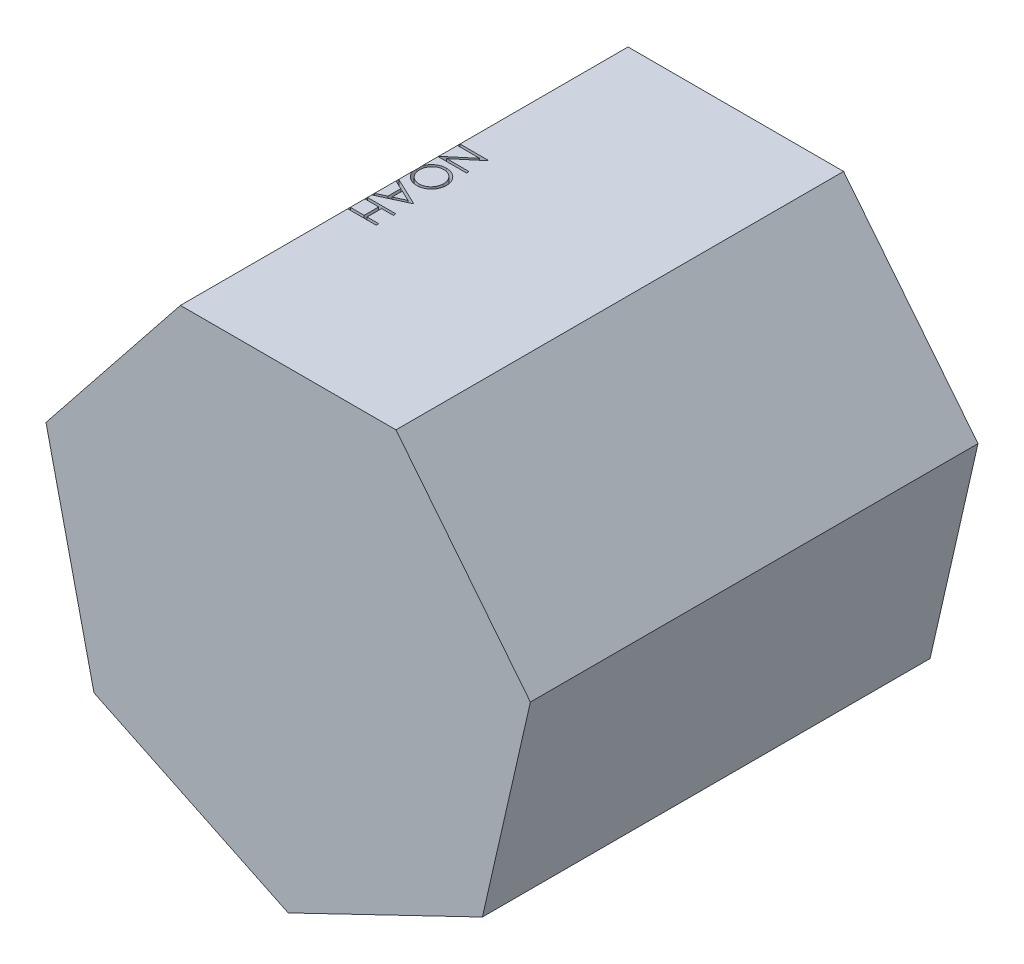
from build123d import *

# Parameters (mm, degrees)
BOSS_EXTRUDE1_DEPTH = 200
CUT_EXTRUDE1_DEPTH  = 1
SKETCH4_W           = 1.794871794
SKETCH4_H           = 20.512820513
SKETCH4_W_2         = 1.794871795
SKETCH4_H_2         = 14.615384616
CUT_EXTRUDE3_DEPTH  = 1
CUT_EXTRUDE5_DEPTH  = 2
CUT_EXTRUDE6_DEPTH  = 10


with BuildPart() as part:
    # Sketch1 → Boss-Extrude1 (new body)
    with BuildSketch(Plane.XY):
        Polygon((0, -110.991626417), (86.776747824, -69.202147163), (108.208834613, 24.697960372), (48.157461881, 100), (-48.157461881, 100), (-108.208834613, 24.697960372), (-86.776747824, -69.202147163), align=None)
    extrude(amount=BOSS_EXTRUDE1_DEPTH)

    # Sketch2 → Cut-Extrude1 (cut)
    # profile 1 of 6: a face of its own
    with BuildSketch(Plane(origin=(-78.183148247, 62.348980186, 0), x_dir=(0, 0, 1), z_dir=(-0.7818314824680302, 0.6234898018587328, 0))):
        with BuildLine():
            Line((145.128205128, -35.364993932), (143.91025641, -36.619000342))
            add(Edge.make_bspline(
                [(143.91025641, -36.619000342), (143.805167819, -36.497210935), (143.602569386, -36.262415294), (143.281246637, -35.9484892), (142.961111759, -35.684849549), (142.64654711, -35.462265212), (142.329642716, -35.293984375), (142.014117469, -35.171156592), (141.699644678, -35.095146274), (141.489438762, -35.085349481), (141.386217949, -35.080538804)],
                knots=[0, 0, 0, 0, 1.26578478, 2.440284043, 3.530471711, 4.527705817, 5.468200915, 6.346673037, 7.188140097, 8, 8, 8, 8], degree=3))
            add(Edge.make_bspline(
                [(141.386217949, -35.080538804), (141.25970715, -35.086680935), (141.010751801, -35.09876778), (140.65403284, -35.219415954), (140.322886411, -35.404608745), (140.036275097, -35.667286365), (139.793488354, -35.968796473), (139.616267319, -36.305918329), (139.50789027, -36.668478579), (139.494148944, -36.920077766), (139.487179487, -37.04768624)],
                knots=[0, 0, 0, 0, 0.99966794, 1.967205029, 2.953328237, 3.988086729, 5.028030931, 6.008226631, 6.989793394, 8, 8, 8, 8], degree=3))
            add(Edge.make_bspline(
                [(139.487179487, -37.04768624), (139.493526986, -37.163183635), (139.50620409, -37.39385284), (139.604756542, -37.734127319), (139.761705526, -38.065881823), (139.908392351, -38.26909843), (139.983974359, -38.373808035)],
                knots=[0, 0, 0, 0, 0.960159726, 1.917612774, 2.927026955, 4, 4, 4, 4], degree=3))
            add(Edge.make_bspline(
                [(139.983974359, -38.373808035), (140.029480038, -38.429719945), (140.126333139, -38.5487214), (140.308096082, -38.713886276), (140.513938956, -38.896413425), (140.761481457, -39.078909636), (141.040058759, -39.271090923), (141.355711812, -39.465388826), (141.698423269, -39.676614111), (141.943779307, -39.810582314), (142.071314103, -39.880218291)],
                knots=[0, 0, 0, 0, 0.66740084, 1.420478572, 2.27185888, 3.217733974, 4.268547843, 5.408967954, 6.65319498, 8, 8, 8, 8], degree=3))
            add(Edge.make_bspline(
                [(142.071314103, -39.880218291), (142.226820257, -39.967332021), (142.527206943, -40.135607064), (142.954022756, -40.396805369), (143.341377276, -40.656413508), (143.69255252, -40.911655073), (144.000791428, -41.169671459), (144.275446014, -41.420572928), (144.509665694, -41.671940404), (144.640830989, -41.847558196), (144.703525641, -41.931500342)],
                knots=[0, 0, 0, 0, 1.27191281, 2.456916733, 3.569705269, 4.599008579, 5.553216877, 6.436649441, 7.252746552, 8, 8, 8, 8], degree=3))
            add(Edge.make_bspline(
                [(144.703525641, -41.931500342), (144.807585798, -42.101020845), (145.014684822, -42.438398109), (145.232160631, -42.99393198), (145.358219344, -43.583134851), (145.375717745, -43.986176109), (145.384615385, -44.191115727)],
                knots=[0, 0, 0, 0, 0.995354457, 1.980940102, 2.973342416, 4, 4, 4, 4], degree=3))
            add(Edge.make_bspline(
                [(145.384615385, -44.191115727), (145.380503763, -44.335510848), (145.372401363, -44.620057209), (145.316069552, -45.039113379), (145.219183973, -45.439882279), (145.087219665, -45.826712477), (144.909023248, -46.192192132), (144.700178693, -46.545542126), (144.449464911, -46.879118874), (144.163228479, -47.19248436), (143.849825657, -47.478688631), (143.515504866, -47.730254082), (143.159854405, -47.939250295), (142.78541554, -48.112195125), (142.391337517, -48.249728027), (141.977558721, -48.344942491), (141.545394409, -48.401929698), (141.251509791, -48.40984099), (141.101762821, -48.413872137)],
                knots=[0, 0, 0, 0, 1.032770009, 2.035186124, 3.017557409, 3.978232242, 4.952395191, 5.920591857, 6.910227898, 7.931268572, 8.952309245, 9.941945286, 10.918353717, 11.897095711, 12.887975737, 13.898235213, 14.929059601, 16, 16, 16, 16], degree=3))
            add(Edge.make_bspline(
                [(141.101762821, -48.413872137), (140.899664675, -48.408199564), (140.498276521, -48.396933237), (139.904620983, -48.291184316), (139.324502362, -48.126639208), (138.762310703, -47.899691013), (138.230618624, -47.613115511), (137.744156198, -47.269901833), (137.301233555, -46.881387562), (137.049129134, -46.583599501), (136.923076923, -46.43470547)],
                knots=[0, 0, 0, 0, 1.013940152, 2.01379169, 3.017749504, 4.037548394, 5.051665909, 6.043208538, 7.021604269, 8, 8, 8, 8], degree=3))
            Line((136.923076923, -46.43470547), (138.112980769, -45.080538804))
            add(Edge.make_bspline(
                [(138.112980769, -45.080538804), (138.225965986, -45.20256603), (138.445004913, -45.439134258), (138.795297581, -45.75413049), (139.151751301, -46.018137754), (139.510806653, -46.238957267), (139.877778621, -46.409102428), (140.250610702, -46.52863725), (140.628544554, -46.605461206), (140.88238533, -46.614479962), (141.009615385, -46.619000342)],
                knots=[0, 0, 0, 0, 1.179806542, 2.287233372, 3.337373186, 4.324005949, 5.273901747, 6.200048787, 7.097828587, 8, 8, 8, 8], degree=3))
            add(Edge.make_bspline(
                [(141.009615385, -46.619000342), (141.182860676, -46.611167057), (141.521352913, -46.595862133), (142.006174391, -46.456907321), (142.453823685, -46.239021882), (142.842528517, -45.929966464), (143.173398009, -45.570220335), (143.412987577, -45.164996796), (143.563137151, -44.726188472), (143.580771429, -44.422003886), (143.58974359, -44.267237522)],
                knots=[0, 0, 0, 0, 1.072336372, 2.095165389, 3.102688358, 4.141489647, 5.156069229, 6.117746104, 7.042326257, 8, 8, 8, 8], degree=3))
            add(Edge.make_bspline(
                [(143.58974359, -44.267237522), (143.583536194, -44.139753987), (143.571280521, -43.888054811), (143.475033252, -43.523767148), (143.322959811, -43.178228402), (143.173218963, -42.976001846), (143.096955128, -42.873006753)],
                knots=[0, 0, 0, 0, 1.013901739, 2.00181326, 2.98231254, 4, 4, 4, 4], degree=3))
            add(Edge.make_bspline(
                [(143.096955128, -42.873006753), (143.051112874, -42.821376112), (142.951251889, -42.708905929), (142.768079082, -42.546476907), (142.548754155, -42.371402054), (142.290810367, -42.186650118), (141.993727727, -41.994658087), (141.656302153, -41.796433217), (141.283156139, -41.582560499), (141.01932396, -41.440733897), (140.881410256, -41.366596496)],
                knots=[0, 0, 0, 0, 0.615000592, 1.339693406, 2.178160186, 3.116406724, 4.166410947, 5.330106347, 6.604359322, 8, 8, 8, 8], degree=3))
            add(Edge.make_bspline(
                [(140.881410256, -41.366596496), (140.732572313, -41.283515744), (140.443928042, -41.122395651), (140.035086379, -40.871446621), (139.666244355, -40.616205051), (139.328526786, -40.370988827), (139.030463897, -40.122869147), (138.773229907, -39.871570567), (138.546697245, -39.62722779), (138.421283463, -39.45410038), (138.361378205, -39.371404188)],
                knots=[0, 0, 0, 0, 1.262093308, 2.447601706, 3.550203992, 4.582594899, 5.537233252, 6.418365656, 7.244515135, 8, 8, 8, 8], degree=3))
            add(Edge.make_bspline(
                [(138.361378205, -39.371404188), (138.257774779, -39.204857817), (138.05053172, -38.871706872), (137.849302056, -38.315647005), (137.710981891, -37.730246678), (137.698625376, -37.326321796), (137.692307692, -37.119801624)],
                knots=[0, 0, 0, 0, 0.985009483, 1.970363186, 2.962279964, 4, 4, 4, 4], degree=3))
            add(Edge.make_bspline(
                [(137.692307692, -37.119801624), (137.695360237, -36.98479935), (137.701334499, -36.720580773), (137.749014794, -36.332358943), (137.835824572, -35.96351235), (137.944709844, -35.608501704), (138.096041298, -35.274204024), (138.276875042, -34.956161332), (138.489374613, -34.654813229), (138.734193418, -34.374795331), (139.003374248, -34.120456324), (139.294201504, -33.898749878), (139.600134398, -33.709570708), (139.922468224, -33.550912648), (140.264299498, -33.430904747), (140.623238849, -33.348291118), (140.998559734, -33.293118531), (141.255137597, -33.28818662), (141.386217949, -33.285667009)],
                knots=[0, 0, 0, 0, 1.087655834, 2.128696564, 3.144119009, 4.137814668, 5.115653402, 6.093965665, 7.082169637, 8.081268856, 9.086088321, 10.061021666, 11.022561449, 11.980240094, 12.950172527, 13.934149372, 14.944599409, 16, 16, 16, 16], degree=3))
            add(Edge.make_bspline(
                [(141.386217949, -33.285667009), (141.541601169, -33.291977527), (141.855282436, -33.304716943), (142.325880299, -33.405892317), (142.795785111, -33.572367198), (143.266204254, -33.802288531), (143.733691622, -34.099813536), (144.202359374, -34.459409533), (144.677833833, -34.878710759), (144.974727051, -35.199277761), (145.128205128, -35.364993932)],
                knots=[0, 0, 0, 0, 0.845714091, 1.707292901, 2.609013841, 3.555613372, 4.552488639, 5.621697636, 6.770543573, 8, 8, 8, 8], degree=3))
        make_face()
    # profile 2 of 6: a face of its own
    with BuildSketch(Plane(origin=(-78.183148247, 62.348980186, 0), x_dir=(0, 0, 1), z_dir=(-0.7818314824680302, 0.6234898018587328, 0))):
        with BuildLine():
            Line((132.251602564, -43.542077265), (133.846153846, -44.379417009))
            add(Edge.make_bspline(
                [(133.846153846, -44.379417009), (133.719087588, -44.604807473), (133.471866968, -45.043328061), (133.046719837, -45.645795835), (132.601050851, -46.187782783), (132.114742462, -46.654809379), (131.602344297, -47.06196015), (131.061014841, -47.418176291), (130.487935882, -47.721710693), (129.883080312, -47.977439424), (129.241368591, -48.174065104), (128.56124564, -48.312946367), (127.841408524, -48.398793616), (127.348001782, -48.408765849), (127.095352564, -48.413872137)],
                knots=[0, 0, 0, 0, 1.120438281, 2.179929193, 3.190490725, 4.156257408, 5.095198341, 6.022838206, 6.959905092, 7.901321166, 8.864066838, 9.862729781, 10.905609505, 12, 12, 12, 12], degree=3))
            add(Edge.make_bspline(
                [(127.095352564, -48.413872137), (126.814541264, -48.40731685), (126.266759769, -48.394529383), (125.469389785, -48.284286729), (124.718650252, -48.104444679), (124.014583375, -47.853213013), (123.35891336, -47.525056876), (122.750337047, -47.125288408), (122.185654042, -46.655961239), (121.682658561, -46.113010133), (121.229836374, -45.531970377), (120.83026026, -44.92650818), (120.496217797, -44.298146897), (120.224488596, -43.65088676), (120.005032225, -42.988807368), (119.852079632, -42.305884696), (119.763909643, -41.603967072), (119.750398526, -41.129125154), (119.743589744, -40.889833676)],
                knots=[0, 0, 0, 0, 1.145258523, 2.234067595, 3.276747158, 4.290159414, 5.277019952, 6.260822364, 7.254936242, 8.264827045, 9.274100331, 10.257902744, 11.220704747, 12.172965371, 13.118907548, 14.062713208, 15.023725156, 16, 16, 16, 16], degree=3))
            add(Edge.make_bspline(
                [(119.743589744, -40.889833676), (119.74964198, -40.665291788), (119.761636713, -40.220279418), (119.837241212, -39.561619163), (119.971231458, -38.921456578), (120.155096166, -38.299259732), (120.392531859, -37.696070395), (120.683001683, -37.11152146), (121.026958127, -36.546234946), (121.292516263, -36.189645611), (121.426282051, -36.010025983)],
                knots=[0, 0, 0, 0, 1.024358464, 2.0301432, 3.019427413, 4.004406732, 4.986367066, 5.972626655, 6.978780325, 8, 8, 8, 8], degree=3))
            add(Edge.make_bspline(
                [(121.426282051, -36.010025983), (121.60746881, -35.79363244), (121.964102791, -35.367700152), (122.567281964, -34.808052576), (123.220425943, -34.339231003), (123.915349521, -33.950618797), (124.660129373, -33.655340814), (125.444753893, -33.435297487), (126.278157243, -33.311994567), (126.847901362, -33.294578375), (127.139423077, -33.285667009)],
                knots=[0, 0, 0, 0, 1.030682036, 2.02871468, 2.997146059, 3.962720338, 4.930598197, 5.918074684, 6.934738563, 8, 8, 8, 8], degree=3))
            add(Edge.make_bspline(
                [(127.139423077, -33.285667009), (127.439123679, -33.293404431), (128.027067941, -33.30858349), (128.884394347, -33.449305395), (129.695598442, -33.67246285), (130.460355609, -33.987627367), (131.178743385, -34.394253377), (131.84609224, -34.897921043), (132.473815168, -35.483167255), (132.839007048, -35.933242738), (133.024839744, -36.162269573)],
                knots=[0, 0, 0, 0, 1.056321875, 2.072262726, 3.055038591, 4.01806755, 4.982017516, 5.957941055, 6.960871419, 8, 8, 8, 8], degree=3))
            add(Edge.make_bspline(
                [(133.024839744, -36.162269573), (133.151279391, -36.334861467), (133.403317066, -36.678896431), (133.71901478, -37.239874471), (133.993057037, -37.826792153), (134.212102529, -38.449136708), (134.389471107, -39.099534309), (134.517795786, -39.782634564), (134.593050749, -40.498234058), (134.607843305, -40.985814375), (134.615384615, -41.234384958)],
                knots=[0, 0, 0, 0, 0.94817472, 1.890038105, 2.849395472, 3.817997239, 4.812318967, 5.836947057, 6.897266129, 8, 8, 8, 8], degree=3))
            Line((134.615384615, -41.234384958), (121.538461538, -41.234384958))
            add(Edge.make_bspline(
                [(121.538461538, -41.234384958), (121.547259289, -41.426959039), (121.564559712, -41.805648203), (121.645217673, -42.359766964), (121.772353523, -42.887614633), (121.951033881, -43.385232016), (122.167415854, -43.859118459), (122.432477093, -44.30575867), (122.748703115, -44.723118271), (123.101421398, -45.114930485), (123.494033371, -45.463849121), (123.907077641, -45.776144985), (124.346469441, -46.037891252), (124.808744203, -46.250347765), (125.293154404, -46.416669571), (125.799852662, -46.530199975), (126.327841898, -46.606240585), (126.687760379, -46.614695815), (126.87099359, -46.619000342)],
                knots=[0, 0, 0, 0, 1.094153842, 2.151609401, 3.174256925, 4.172055639, 5.149267565, 6.128595816, 7.11444997, 8.118368179, 9.117203808, 10.09244225, 11.054858984, 12.015122123, 12.976791628, 13.957293641, 14.960065497, 16, 16, 16, 16], degree=3))
            add(Edge.make_bspline(
                [(126.87099359, -46.619000342), (127.050143005, -46.615525733), (127.40560981, -46.608631441), (127.934986138, -46.54159195), (128.455783437, -46.433190375), (128.965846199, -46.285247575), (129.454822461, -46.10480842), (129.907654176, -45.887077805), (130.324112551, -45.646222109), (130.71335236, -45.370738252), (131.090900893, -45.033548612), (131.465429387, -44.612773063), (131.867010263, -44.115130047), (132.118379365, -43.740583384), (132.251602564, -43.542077265)],
                knots=[0, 0, 0, 0, 0.99110716, 1.966546729, 2.947904876, 3.932708344, 4.903319531, 5.828989031, 6.710028674, 7.56322171, 8.463672341, 9.504779593, 10.677557249, 12, 12, 12, 12], degree=3))
        make_face()
        with BuildLine():
            add(Edge.make_bspline(
                [(132.820512821, -39.439513163), (132.754817823, -39.201439599), (132.6283761, -38.743224624), (132.364168303, -38.10870525), (132.066616642, -37.544774387), (131.714492463, -37.055747912), (131.315528317, -36.621442124), (130.854698701, -36.241907352), (130.337922167, -35.90237906), (129.767869935, -35.615793349), (129.164202592, -35.371851299), (128.532167209, -35.208279209), (127.887265564, -35.096224681), (127.451069642, -35.085789776), (127.231570513, -35.080538804)],
                knots=[0, 0, 0, 0, 1.154881502, 2.222775134, 3.210006277, 4.132804581, 5.035138423, 5.962687519, 6.919655026, 7.923214229, 8.944639381, 9.960483929, 10.97369054, 12, 12, 12, 12], degree=3))
            add(Edge.make_bspline(
                [(127.231570513, -35.080538804), (127.052430864, -35.08403407), (126.698309441, -35.090943476), (126.176589051, -35.156487072), (125.6755622, -35.264829043), (125.191531985, -35.413200223), (124.730841309, -35.610963666), (124.284014062, -35.842867818), (123.862411798, -36.125962583), (123.598747252, -36.341727468), (123.465544872, -36.450731112)],
                knots=[0, 0, 0, 0, 1.04873581, 2.073130211, 3.073294108, 4.04793562, 5.032784715, 6.005352987, 6.992311501, 8, 8, 8, 8], degree=3))
            add(Edge.make_bspline(
                [(123.465544872, -36.450731112), (123.370154689, -36.536984344), (123.177108208, -36.711539864), (122.919162371, -37.012278187), (122.672188241, -37.336572828), (122.447424511, -37.696830683), (122.241266874, -38.08894942), (122.048352719, -38.509621621), (121.874716078, -38.962039509), (121.777024021, -39.27731059), (121.726762821, -39.439513163)],
                knots=[0, 0, 0, 0, 0.879870761, 1.780643979, 2.707998968, 3.669668524, 4.684282772, 5.740141944, 6.837334558, 8, 8, 8, 8], degree=3))
            Line((121.726762821, -39.439513163), (132.820512821, -39.439513163))
        make_face(mode=Mode.SUBTRACT)
    # profile 3 of 6: a face of its own
    with BuildSketch(Plane(origin=(-78.183148247, 62.348980186, 0), x_dir=(0, 0, 1), z_dir=(-0.7818314824680302, 0.6234898018587328, 0))):
        with BuildLine():
            Line((111.538461538, -33.542077265), (113.333333333, -33.542077265))
            Line((113.333333333, -33.542077265), (113.333333333, -35.693519573))
            add(Edge.make_bspline(
                [(113.333333333, -35.693519573), (113.465840526, -35.493200554), (113.719259503, -35.110091987), (114.140476242, -34.603410267), (114.571923849, -34.183895715), (115.015667777, -33.849589893), (115.474971205, -33.599229214), (115.939753786, -33.415840442), (116.4173279, -33.307398641), (116.738253181, -33.29292059), (116.899038462, -33.285667009)],
                knots=[0, 0, 0, 0, 1.2804753, 2.448899062, 3.506932113, 4.484331642, 5.4025378, 6.288909075, 7.142734305, 8, 8, 8, 8], degree=3))
            add(Edge.make_bspline(
                [(116.899038462, -33.285667009), (117.023760327, -33.292470018), (117.280383671, -33.306467651), (117.668855613, -33.404815221), (118.06910391, -33.561832493), (118.327060408, -33.709490908), (118.461538462, -33.786468291)],
                knots=[0, 0, 0, 0, 0.901110191, 1.854092781, 2.881294221, 4, 4, 4, 4], degree=3))
            Line((118.461538462, -33.786468291), (117.475961538, -35.34095547))
            add(Edge.make_bspline(
                [(117.475961538, -35.34095547), (117.389624275, -35.302439664), (117.22573962, -35.22932929), (116.985999242, -35.142803518), (116.764963032, -35.091855428), (116.624142698, -35.084137042), (116.55849359, -35.080538804)],
                knots=[0, 0, 0, 0, 1.180555205, 2.24091978, 3.179933427, 4, 4, 4, 4], degree=3))
            add(Edge.make_bspline(
                [(116.55849359, -35.080538804), (116.414460827, -35.090139017), (116.120675741, -35.10972067), (115.689335745, -35.263656715), (115.270780285, -35.512372372), (114.938370786, -35.788207297), (114.680986483, -36.054194711), (114.497328052, -36.286471297), (114.328855212, -36.54692062), (114.167882524, -36.831090242), (114.021217986, -37.143832219), (113.884334162, -37.48202201), (113.760569231, -37.846051318), (113.689996407, -38.099665719), (113.653846154, -38.229577265)],
                knots=[0, 0, 0, 0, 1.125678352, 2.296057538, 3.5422874, 4.923748041, 5.663163013, 6.437101912, 7.23742474, 8.08941207, 8.991984279, 9.93940061, 10.944477711, 12, 12, 12, 12], degree=3))
            add(Edge.make_bspline(
                [(113.653846154, -38.229577265), (113.626803906, -38.345446829), (113.566907382, -38.602089107), (113.508670023, -39.032652105), (113.45112992, -39.541358727), (113.410577815, -40.129624972), (113.372989003, -40.795981794), (113.351788533, -41.54144434), (113.334056302, -42.366777776), (113.333581634, -42.94377408), (113.333333333, -43.245602906)],
                knots=[0, 0, 0, 0, 0.566838948, 1.255505196, 2.06880316, 3.007127437, 4.065329342, 5.249902469, 6.561414163, 8, 8, 8, 8], degree=3))
            Line((113.333333333, -43.245602906), (113.333333333, -48.157461881))
            Line((113.333333333, -48.157461881), (111.538461538, -48.157461881))
            Line((111.538461538, -48.157461881), (111.538461538, -33.542077265))
        make_face()
    # profile 4 of 6: a face of its own
    with BuildSketch(Plane(origin=(-78.183148247, 62.348980186, 0), x_dir=(0, 0, 1), z_dir=(-0.7818314824680302, 0.6234898018587328, 0))):
        with BuildLine():
            Line((107.948717949, -27.644641368), (107.948717949, -48.157461881))
            Line((107.948717949, -48.157461881), (106.153846154, -48.157461881))
            Line((106.153846154, -48.157461881), (106.153846154, -45.629417009))
            add(Edge.make_bspline(
                [(106.153846154, -45.629417009), (105.951453065, -45.858214689), (105.556480406, -46.304716238), (104.896816875, -46.888042938), (104.197570144, -47.370204775), (103.462134023, -47.759632865), (102.691172632, -48.052158901), (101.886394991, -48.26007981), (101.047472814, -48.393758868), (100.474602216, -48.407107565), (100.184294872, -48.413872137)],
                knots=[0, 0, 0, 0, 1.074387032, 2.096679803, 3.090159297, 4.057316773, 5.018401886, 5.985159533, 6.978961417, 8, 8, 8, 8], degree=3))
            add(Edge.make_bspline(
                [(100.184294872, -48.413872137), (99.926192278, -48.406864296), (99.417202536, -48.393044522), (98.668464953, -48.285831358), (97.947937813, -48.113656377), (97.254940255, -47.874222723), (96.593956567, -47.556618028), (95.959327443, -47.176382325), (95.354340631, -46.723577582), (94.788217551, -46.205931705), (94.266891835, -45.643674636), (93.809398849, -45.043985797), (93.427952678, -44.409458346), (93.108980788, -43.748126038), (92.863287391, -43.054897926), (92.692009481, -42.332171252), (92.584921215, -41.580800546), (92.571107153, -41.069146129), (92.564102564, -40.80970547)],
                knots=[0, 0, 0, 0, 1.033919861, 2.038935746, 3.024066025, 3.998881131, 4.97069526, 5.957263378, 6.95902576, 7.993208707, 9.027059324, 10.027763471, 11.009749337, 11.988697705, 12.965288445, 13.950418724, 14.960734635, 16, 16, 16, 16], degree=3))
            add(Edge.make_bspline(
                [(92.564102564, -40.80970547), (92.571262401, -40.555627164), (92.585417011, -40.05332806), (92.690863982, -39.314592643), (92.868184031, -38.603059724), (93.117028875, -37.921020049), (93.43612576, -37.267648333), (93.824286258, -36.642482476), (94.281538399, -36.043800205), (94.80869501, -35.485678909), (95.37975084, -34.970132542), (95.990657874, -34.522080853), (96.626219481, -34.135127432), (97.296293827, -33.828536138), (97.990962997, -33.580484112), (98.716411259, -33.408867152), (99.46962028, -33.307739602), (99.98099452, -33.293095235), (100.240384615, -33.285667009)],
                knots=[0, 0, 0, 0, 1.020392517, 2.01726096, 2.990465484, 3.961182959, 4.928053699, 5.906110375, 6.912531644, 7.948652711, 8.985773172, 9.998621852, 10.987621588, 11.969261332, 12.953316658, 13.946091881, 14.958173133, 16, 16, 16, 16], degree=3))
            add(Edge.make_bspline(
                [(100.240384615, -33.285667009), (100.538766374, -33.294621843), (101.124456606, -33.312199188), (101.981019586, -33.459092714), (102.791234504, -33.70573773), (103.559765861, -34.043402195), (104.282031919, -34.482263631), (104.963327008, -35.012271904), (105.591803139, -35.648427025), (105.963642125, -36.126207444), (106.153846154, -36.370602906)],
                knots=[0, 0, 0, 0, 1.031072012, 2.023879775, 2.993683497, 3.952812103, 4.918022106, 5.908088563, 6.929940113, 8, 8, 8, 8], degree=3))
            Line((106.153846154, -36.370602906), (106.153846154, -27.644641368))
            Line((106.153846154, -27.644641368), (107.948717949, -27.644641368))
        make_face()
        with BuildLine():
            add(Edge.make_bspline(
                [(100.264423077, -35.080538804), (100.002055432, -35.089873877), (99.484183432, -35.108299825), (98.723931992, -35.252148369), (97.996426768, -35.491488909), (97.305306344, -35.818814058), (96.661487963, -36.230406839), (96.086095559, -36.728243315), (95.574422979, -37.298740538), (95.144090041, -37.939324026), (94.793287201, -38.626055975), (94.546618447, -39.343909907), (94.383937034, -40.07993835), (94.367316916, -40.579153698), (94.358974359, -40.829737522)],
                knots=[0, 0, 0, 0, 1.031046209, 2.035121221, 3.029706178, 4.034933723, 5.034054252, 6.02443088, 7.017295772, 8.038157696, 9.050218397, 10.03989886, 11.016116709, 12, 12, 12, 12], degree=3))
            add(Edge.make_bspline(
                [(94.358974359, -40.829737522), (94.369630892, -41.078823849), (94.390902189, -41.576020168), (94.543763299, -42.313052035), (94.800219719, -43.031075133), (95.150174363, -43.723995095), (95.588383647, -44.367332812), (96.096318805, -44.948704941), (96.678891841, -45.448645445), (97.324191881, -45.867145866), (98.013380284, -46.205217414), (98.738145606, -46.44044964), (99.484863539, -46.592322672), (99.992591161, -46.610062539), (100.248397436, -46.619000342)],
                knots=[0, 0, 0, 0, 0.979072187, 1.954306742, 2.945804271, 3.96968567, 4.997920485, 5.998718438, 6.996577872, 8.005894225, 9.015743152, 10.005417472, 10.995077863, 12, 12, 12, 12], degree=3))
            add(Edge.make_bspline(
                [(100.248397436, -46.619000342), (100.508091737, -46.609514834), (101.024597946, -46.590649099), (101.787104848, -46.446184726), (102.527076064, -46.207505878), (103.234431655, -45.876653726), (103.893380976, -45.466611692), (104.484797419, -44.986571172), (104.984888667, -44.428267263), (105.408846436, -43.814687531), (105.741277389, -43.142047551), (105.983426298, -42.425852175), (106.126591474, -41.666076472), (106.144635644, -41.146854032), (106.153846154, -40.881820855)],
                knots=[0, 0, 0, 0, 1.01762866, 2.023962475, 3.030623092, 4.058876274, 5.077231937, 6.066672613, 7.034107872, 8.005628644, 8.981990164, 9.965428785, 10.961468474, 12, 12, 12, 12], degree=3))
            add(Edge.make_bspline(
                [(106.153846154, -40.881820855), (106.148362403, -40.679890395), (106.137568646, -40.282427347), (106.055108249, -39.698841533), (105.923937241, -39.140363098), (105.739101984, -38.606404875), (105.496294644, -38.099919073), (105.203450268, -37.617269014), (104.855419126, -37.160964949), (104.45780372, -36.737290258), (104.022573991, -36.350853331), (103.562033759, -36.005914812), (103.070726634, -35.722550397), (102.556914994, -35.488028845), (102.019707369, -35.301405132), (101.454732398, -35.176904024), (100.86799533, -35.091416476), (100.467732156, -35.084202871), (100.264423077, -35.080538804)],
                knots=[0, 0, 0, 0, 1.050140795, 2.067009409, 3.05949893, 4.030605086, 5.00011959, 5.97591094, 6.962425594, 7.979863591, 8.993523472, 9.986985069, 10.967611495, 11.937549037, 12.921786183, 13.919465291, 14.943216303, 16, 16, 16, 16], degree=3))
        make_face(mode=Mode.SUBTRACT)
    # profile 5 of 6: a face of its own
    with BuildSketch(Plane(origin=(-78.183148247, 62.348980186, 0), x_dir=(0, 0, 1), z_dir=(-0.7818314824680302, 0.6234898018587328, 0))):
        with BuildLine():
            Line((76.153846154, -33.542077265), (77.948717949, -33.542077265))
            Line((77.948717949, -33.542077265), (77.948717949, -36.178295214))
            add(Edge.make_bspline(
                [(77.948717949, -36.178295214), (78.140361578, -35.939193941), (78.512252727, -35.475209578), (79.131591774, -34.865377723), (79.786128347, -34.36283358), (80.471854082, -33.962240472), (81.189699854, -33.660259751), (81.935289968, -33.442168716), (82.713088288, -33.311398268), (83.242027928, -33.294311237), (83.509615385, -33.285667009)],
                knots=[0, 0, 0, 0, 1.12780773, 2.188550248, 3.19190651, 4.159438251, 5.104880172, 6.052711206, 7.014878035, 8, 8, 8, 8], degree=3))
            add(Edge.make_bspline(
                [(83.509615385, -33.285667009), (83.780076151, -33.295639554), (84.30943311, -33.315158231), (85.080164889, -33.469539323), (85.800012853, -33.733226495), (86.466410315, -34.094438326), (87.067137248, -34.543618174), (87.594707828, -35.066919784), (88.031069241, -35.66884026), (88.323625601, -36.227258296), (88.516343588, -36.722622834), (88.637671231, -37.146889978), (88.740705411, -37.619565127), (88.830029685, -38.139219922), (88.890470325, -38.709495295), (88.938140562, -39.328053535), (88.972304529, -39.994694281), (88.973659998, -40.455760723), (88.974358974, -40.693519573)],
                knots=[0, 0, 0, 0, 1.235846778, 2.418850247, 3.575807741, 4.728682307, 5.871620074, 6.994088408, 8.11269785, 9.256955736, 9.865816715, 10.540099792, 11.271859618, 12.076849838, 12.949306005, 13.892391288, 14.913166135, 16, 16, 16, 16], degree=3))
            Line((88.974358974, -40.693519573), (88.974358974, -48.157461881))
            Line((88.974358974, -48.157461881), (87.179487179, -48.157461881))
            Line((87.179487179, -48.157461881), (87.179487179, -41.282461881))
            add(Edge.make_bspline(
                [(87.179487179, -41.282461881), (87.178383134, -41.083476481), (87.176271282, -40.702851277), (87.169610444, -40.15788543), (87.153554406, -39.66367641), (87.130992618, -39.22140574), (87.097969586, -38.831498102), (87.06355455, -38.493159378), (87.021468968, -38.206819135), (86.983966608, -38.034447236), (86.967147436, -37.957141368)],
                knots=[0, 0, 0, 0, 1.430800155, 2.736877192, 3.918605307, 4.986035426, 5.920637409, 6.731861385, 7.431261377, 8, 8, 8, 8], degree=3))
            add(Edge.make_bspline(
                [(86.967147436, -37.957141368), (86.906430113, -37.730220311), (86.789568052, -37.293467485), (86.500802434, -36.701042613), (86.136149973, -36.197052968), (85.691019405, -35.784614559), (85.169710401, -35.463638349), (84.573669585, -35.240930036), (83.908648781, -35.101637069), (83.440909452, -35.087767743), (83.197115385, -35.080538804)],
                knots=[0, 0, 0, 0, 1.084156227, 2.086665306, 3.027808233, 3.945421172, 4.874247719, 5.839848303, 6.874090471, 8, 8, 8, 8], degree=3))
            add(Edge.make_bspline(
                [(83.197115385, -35.080538804), (83.052728621, -35.08325883), (82.766990947, -35.088641693), (82.343276822, -35.14264911), (81.932281546, -35.230983142), (81.529880352, -35.350232499), (81.144121531, -35.514016895), (80.762611295, -35.69989901), (80.3997155, -35.931603079), (80.047696088, -36.189835201), (79.72019433, -36.4760021), (79.415460968, -36.777970729), (79.143815138, -37.099545608), (78.897708422, -37.435545308), (78.685261203, -37.790584382), (78.499814985, -38.161237562), (78.342468158, -38.547992698), (78.264281344, -38.81642162), (78.225160256, -38.950731112)],
                knots=[0, 0, 0, 0, 1.023777757, 2.026029729, 3.023749952, 4.003683103, 4.997618607, 5.993177895, 7.010360494, 8.046726602, 9.087585522, 10.09234134, 11.086953743, 12.070360549, 13.043493632, 14.017870808, 15.008233677, 16, 16, 16, 16], degree=3))
            add(Edge.make_bspline(
                [(78.225160256, -38.950731112), (78.202647979, -39.049332272), (78.153639928, -39.26398184), (78.100707472, -39.616235665), (78.052664184, -40.023721236), (78.012452992, -40.485963048), (77.987850612, -41.004579477), (77.961025487, -41.577355693), (77.951259424, -42.206575627), (77.94958883, -42.644642442), (77.948717949, -42.873006753)],
                knots=[0, 0, 0, 0, 0.615963638, 1.340920617, 2.168419149, 3.115676021, 4.16674242, 5.331190069, 6.6087489, 8, 8, 8, 8], degree=3))
            Line((77.948717949, -42.873006753), (77.948717949, -48.157461881))
            Line((77.948717949, -48.157461881), (76.153846154, -48.157461881))
            Line((76.153846154, -48.157461881), (76.153846154, -33.542077265))
        make_face()
    # profile 6 of 6: a face of its own
    with BuildSketch(Plane(origin=(-78.183148247, 62.348980186, 0), x_dir=(0, 0, 1), z_dir=(-0.7818314824680302, 0.6234898018587328, 0))):
        Polygon((63.846153846, -28.157461881), (73.076923077, -48.157461881), (71.125801282, -48.157461881), (68.169070513, -41.74720547), (59.102564103, -41.74720547), (56.065705128, -48.157461881), (54.102564103, -48.157461881), (63.58974359, -28.157461881), align=None)
        Polygon((63.697916667, -32.05970547), (60.080128205, -39.695923419), (67.223557692, -39.695923419), align=None, mode=Mode.SUBTRACT)
    extrude(amount=-CUT_EXTRUDE1_DEPTH, mode=Mode.SUBTRACT)

    # Sketch4 → Cut-Extrude3 (cut)
    # profile 1 of 6: a face of its own
    with BuildSketch(Plane(origin=(-97.492791218, -22.252093396, 0), x_dir=(0, 0, 1), z_dir=(-0.9749279121818235, -0.22252093395631528, 0))):
        Polygon((109.743589744, -33.542077265), (111.674679487, -33.542077265), (116.630608974, -44.735987522), (121.650641026, -33.542077265), (123.58974359, -33.542077265), (114.615384615, -53.542077265), (112.676282051, -53.542077265), (115.661057692, -46.90345547), align=None)
    # profile 2 of 6: a face of its own
    with BuildSketch(Plane(origin=(-97.492791218, -22.252093396, 0), x_dir=(0, 0, 1), z_dir=(-0.9749279121818235, -0.22252093395631528, 0))):
        with Locations((106.282051282, -37.901051624)):
            Rectangle(SKETCH4_W, SKETCH4_H)
    # profile 3 of 6: a face of its own
    with BuildSketch(Plane(origin=(-97.492791218, -22.252093396, 0), x_dir=(0, 0, 1), z_dir=(-0.9749279121818235, -0.22252093395631528, 0))):
        with Locations((100.641025641, -37.901051624)):
            Rectangle(SKETCH4_W, SKETCH4_H)
    # profile 4 of 6: a face of its own
    with BuildSketch(Plane(origin=(-97.492791218, -22.252093396, 0), x_dir=(0, 0, 1), z_dir=(-0.9749279121818235, -0.22252093395631528, 0))):
        with BuildLine():
            add(Edge.make_bspline(
                [(94.735576923, -27.388231112), (94.84695587, -27.393397697), (95.065057241, -27.403514863), (95.380447342, -27.490151874), (95.667630268, -27.63700722), (95.92236017, -27.834033968), (96.14094238, -28.065745073), (96.293975011, -28.335807749), (96.39233156, -28.6275714), (96.404209019, -28.831086195), (96.41025641, -28.93470547)],
                knots=[0, 0, 0, 0, 1.055194115, 2.066272739, 3.074728998, 4.095836921, 5.109056067, 6.073838105, 7.019297344, 8, 8, 8, 8], degree=3))
            add(Edge.make_bspline(
                [(96.41025641, -28.93470547), (96.40407264, -29.035634917), (96.391848058, -29.235160489), (96.294050982, -29.521866043), (96.139638194, -29.788176235), (95.922500333, -30.019437436), (95.667593128, -30.216355264), (95.380457209, -30.363239487), (95.065054646, -30.449868843), (94.846954993, -30.459987064), (94.735576923, -30.465154188)],
                knots=[0, 0, 0, 0, 0.96129708, 1.900370562, 2.859976407, 3.87933698, 4.906634145, 5.921202961, 6.938410037, 8, 8, 8, 8], degree=3))
            add(Edge.make_bspline(
                [(94.735576923, -30.465154188), (94.625472494, -30.460184359), (94.411168607, -30.450511234), (94.100500936, -30.361539704), (93.815766711, -30.216305001), (93.56054001, -30.0207268), (93.34779605, -29.786755959), (93.192948476, -29.522028565), (93.095377265, -29.235119111), (93.083122244, -29.035621017), (93.076923077, -28.93470547)],
                knots=[0, 0, 0, 0, 1.054934014, 2.053291228, 3.073705704, 4.106921865, 5.123545215, 6.088680038, 7.033164197, 8, 8, 8, 8], degree=3))
            add(Edge.make_bspline(
                [(93.076923077, -28.93470547), (93.082986429, -28.831100616), (93.094895235, -28.627614144), (93.193021613, -28.335642527), (93.346506229, -28.067176802), (93.560680878, -27.832745377), (93.815729222, -27.637057178), (94.100510623, -27.49185157), (94.411166048, -27.402872488), (94.625471625, -27.393200406), (94.735576923, -27.388231112)],
                knots=[0, 0, 0, 0, 0.98631895, 1.937192651, 2.907499808, 3.917963147, 4.944918757, 5.95915025, 6.951458133, 8, 8, 8, 8], degree=3))
        make_face()
    # profile 5 of 6: a face of its own
    with BuildSketch(Plane(origin=(-97.492791218, -22.252093396, 0), x_dir=(0, 0, 1), z_dir=(-0.9749279121818235, -0.22252093395631528, 0))):
        with Locations((94.743589744, -40.849769573)):
            Rectangle(SKETCH4_W_2, SKETCH4_H_2)
    # profile 6 of 6: a face of its own
    with BuildSketch(Plane(origin=(-97.492791218, -22.252093396, 0), x_dir=(0, 0, 1), z_dir=(-0.9749279121818235, -0.22252093395631528, 0))):
        with BuildLine():
            Line((78.717948718, -28.157461881), (82.620192308, -28.157461881))
            add(Edge.make_bspline(
                [(82.620192308, -28.157461881), (82.811212183, -28.158466169), (83.181456242, -28.160412729), (83.719853053, -28.19060205), (84.224131971, -28.231765878), (84.694439241, -28.297080693), (85.13055754, -28.375890848), (85.533801182, -28.471329797), (85.90288788, -28.585767589), (86.343532089, -28.767746339), (86.845935865, -29.038164444), (87.38992668, -29.437756245), (87.855093762, -29.926513177), (88.256158432, -30.477842637), (88.575021973, -31.084332761), (88.805703672, -31.731528125), (88.951748674, -32.411080936), (88.966768298, -32.877613381), (88.974358974, -33.113391368)],
                knots=[0, 0, 0, 0, 1.001505555, 1.941167018, 2.826882275, 3.653841531, 4.429895133, 5.150066043, 5.825578002, 6.45369114, 7.647487171, 8.808567382, 9.977351308, 11.170798116, 12.373658725, 13.556498008, 14.765093433, 16, 16, 16, 16], degree=3))
            add(Edge.make_bspline(
                [(88.974358974, -33.113391368), (88.968112012, -33.334263115), (88.955836141, -33.768296926), (88.838448945, -34.403120408), (88.654673697, -35.007413087), (88.39921513, -35.578969575), (88.067203723, -36.104875936), (87.673727617, -36.589374599), (87.199003031, -37.011952067), (86.843327374, -37.248197225), (86.662660256, -37.36819906)],
                knots=[0, 0, 0, 0, 1.044552857, 2.05264487, 3.044412934, 4.028983338, 5.005914585, 5.980388656, 6.974128949, 8, 8, 8, 8], degree=3))
            add(Edge.make_bspline(
                [(86.662660256, -37.36819906), (86.8898627, -37.455427626), (87.324557256, -37.622317479), (87.922763042, -37.917377274), (88.438162156, -38.238303619), (88.874717276, -38.588771334), (89.248075304, -38.966535967), (89.574092113, -39.37713662), (89.852271394, -39.825929522), (90.090630957, -40.308235438), (90.276623849, -40.819129543), (90.415914731, -41.353819692), (90.495728726, -41.910388579), (90.507086676, -42.289162175), (90.512820513, -42.480378547)],
                knots=[0, 0, 0, 0, 1.27268992, 2.434971085, 3.483601985, 4.442670788, 5.356604649, 6.2567628, 7.179492994, 8.113709626, 9.066344395, 10.018646069, 10.999752585, 12, 12, 12, 12], degree=3))
            add(Edge.make_bspline(
                [(90.512820513, -42.480378547), (90.507238536, -42.675617817), (90.496255839, -43.059756549), (90.415227429, -43.624071603), (90.278032532, -44.163357013), (90.089054552, -44.681100914), (89.842412755, -45.176301682), (89.542252958, -45.649520333), (89.184358309, -46.096002223), (88.783999058, -46.52070864), (88.331072512, -46.902581711), (87.842411056, -47.242671463), (87.311860656, -47.522363247), (86.748134976, -47.757311941), (86.144910313, -47.936781647), (85.504895413, -48.062339212), (84.82864226, -48.146939423), (84.364586539, -48.15389488), (84.126602564, -48.157461881)],
                knots=[0, 0, 0, 0, 0.978564426, 1.925352924, 2.850884081, 3.763762016, 4.682927383, 5.618979971, 6.567305752, 7.547517671, 8.540179244, 9.531824382, 10.526200242, 11.540722885, 12.589160233, 13.674978461, 14.80764778, 16, 16, 16, 16], degree=3))
            Line((84.126602564, -48.157461881), (78.717948718, -48.157461881))
            Line((78.717948718, -48.157461881), (78.717948718, -28.157461881))
        make_face()
        with BuildLine():
            Line((80.512820513, -30.208743932), (80.512820513, -36.619000342))
            Line((80.512820513, -36.619000342), (81.71875, -36.619000342))
            add(Edge.make_bspline(
                [(81.71875, -36.619000342), (81.895028831, -36.616715068), (82.235635455, -36.612299452), (82.728892007, -36.599650783), (83.186749254, -36.564233392), (83.608416871, -36.528826181), (83.993230837, -36.471257108), (84.340338617, -36.402730692), (84.655187742, -36.330256948), (85.018270859, -36.207002737), (85.430116279, -36.024844593), (85.869162589, -35.742148387), (86.256216701, -35.405437797), (86.583057773, -35.016918016), (86.850551891, -34.58911124), (87.036344549, -34.128843351), (87.16232903, -33.647585454), (87.173709209, -33.317195438), (87.179487179, -33.14944906)],
                knots=[0, 0, 0, 0, 1.156816544, 2.235205308, 3.236616184, 4.169592532, 5.011045266, 5.787822928, 6.49130361, 7.128639758, 8.301311294, 9.436451833, 10.541879658, 11.654887649, 12.756523258, 13.837046038, 14.901820046, 16, 16, 16, 16], degree=3))
            add(Edge.make_bspline(
                [(87.179487179, -33.14944906), (87.176480436, -33.038444652), (87.170582379, -32.820697382), (87.122277793, -32.503272502), (87.040177367, -32.204736773), (86.934724263, -31.920999), (86.787360328, -31.660931284), (86.613854823, -31.415541594), (86.404222307, -31.193186632), (86.165609092, -30.985360927), (85.891274104, -30.801106482), (85.581381008, -30.639730693), (85.231737139, -30.509783397), (84.848235111, -30.395976812), (84.424971754, -30.316043704), (83.966831448, -30.249452918), (83.470061625, -30.215551535), (83.126375325, -30.211063747), (82.948717949, -30.208743932)],
                knots=[0, 0, 0, 0, 0.91205012, 1.789085906, 2.630437955, 3.453916878, 4.269457761, 5.079663411, 5.91843418, 6.774407191, 7.675494373, 8.627863946, 9.638891023, 10.736472738, 11.911756761, 13.175263542, 14.539845004, 16, 16, 16, 16], degree=3))
            Line((82.948717949, -30.208743932), (80.512820513, -30.208743932))
        make_face(mode=Mode.SUBTRACT)
        with BuildLine():
            Line((80.512820513, -38.670282394), (80.512820513, -46.106179829))
            Line((80.512820513, -46.106179829), (83.068910256, -46.106179829))
            add(Edge.make_bspline(
                [(83.068910256, -46.106179829), (83.251875547, -46.103986987), (83.604517025, -46.099760573), (84.113666911, -46.085963118), (84.585570362, -46.054578686), (85.018073994, -46.00517383), (85.415848009, -45.951582692), (85.774120598, -45.87951823), (86.095795989, -45.796952741), (86.468792034, -45.6693289), (86.888812081, -45.471063352), (87.341445546, -45.172124915), (87.743881078, -44.815991728), (88.085625417, -44.403815075), (88.365699637, -43.955636064), (88.569445094, -43.480519779), (88.695107133, -42.986316765), (88.710319529, -42.649364122), (88.717948718, -42.480378547)],
                knots=[0, 0, 0, 0, 1.160039823, 2.235823828, 3.228722157, 4.157150951, 4.99529583, 5.772374946, 6.472645482, 7.099169577, 8.269452708, 9.405989375, 10.527446681, 11.663510218, 12.788923519, 13.866172445, 14.929861265, 16, 16, 16, 16], degree=3))
            add(Edge.make_bspline(
                [(88.717948718, -42.480378547), (88.716370979, -42.374702316), (88.71324095, -42.16505442), (88.666037436, -41.856964025), (88.597386751, -41.558530463), (88.508635701, -41.268943374), (88.379381603, -40.993438367), (88.22848706, -40.726566598), (88.051564765, -40.467975287), (87.775883817, -40.141048124), (87.374901048, -39.764379479), (86.805148046, -39.395593752), (86.157306343, -39.098177711), (85.687434955, -38.97189499), (85.444711538, -38.906660599)],
                knots=[0, 0, 0, 0, 0.723448775, 1.435228256, 2.130040452, 2.821711965, 3.505591119, 4.210454504, 4.921174351, 5.648778258, 7.137944449, 8.670945889, 10.280296675, 12, 12, 12, 12], degree=3))
            add(Edge.make_bspline(
                [(85.444711538, -38.906660599), (85.347402419, -38.886917262), (85.136416177, -38.844109635), (84.792372861, -38.798922759), (84.399596467, -38.758665273), (83.957180026, -38.72888723), (83.464563791, -38.698106981), (82.920695684, -38.686136574), (82.327796743, -38.671855088), (81.916411758, -38.670820035), (81.702724359, -38.670282394)],
                knots=[0, 0, 0, 0, 0.634451884, 1.375622551, 2.216452059, 3.157844607, 4.20941857, 5.370758133, 6.634282058, 8, 8, 8, 8], degree=3))
            Line((81.702724359, -38.670282394), (80.512820513, -38.670282394))
        make_face(mode=Mode.SUBTRACT)
    extrude(amount=-CUT_EXTRUDE3_DEPTH, mode=Mode.SUBTRACT)

    # Sketch7 → Cut-Extrude5 (cut)
    # profile 1 of 4: a face of its own
    with BuildSketch(Plane(origin=(-43.388373912, -90.09688679, 0), x_dir=(-0.9009688679024196, 0.43388373911755734, 0), z_dir=(-0.43388373911755734, -0.9009688679024196, 0))):
        Polygon((-29.107461881, -116.241346154), (-29.107461881, -118.214272837), (-36.899949862, -123.201923077), (-29.107461881, -128.189573317), (-29.107461881, -130.1625), (-38.441656592, -124.190294471), (-48.157461881, -130.406730769), (-48.157461881, -128.433804087), (-39.983363323, -123.201923077), (-48.157461881, -117.970042067), (-48.157461881, -115.997115385), (-38.441656592, -122.217367788), align=None)
    # profile 2 of 4: a face of its own
    with BuildSketch(Plane(origin=(-43.388373912, -90.09688679, 0), x_dir=(-0.9009688679024196, 0.43388373911755734, 0), z_dir=(-0.43388373911755734, -0.9009688679024196, 0))):
        Polygon((-29.107461881, -103.419230769), (-29.107461881, -114.165384615), (-31.061308035, -114.165384615), (-31.061308035, -105.128846154), (-36.922846496, -105.128846154), (-36.922846496, -114.165384615), (-38.87669265, -114.165384615), (-38.87669265, -105.128846154), (-46.203615727, -105.128846154), (-46.203615727, -114.165384615), (-48.157461881, -114.165384615), (-48.157461881, -103.419230769), align=None)
    # profile 3 of 4: a face of its own
    with BuildSketch(Plane(origin=(-43.388373912, -90.09688679, 0), x_dir=(-0.9009688679024196, 0.43388373911755734, 0), z_dir=(-0.43388373911755734, -0.9009688679024196, 0))):
        Polygon((-29.107461881, -91.207692308), (-29.107461881, -92.917307692), (-46.203615727, -92.917307692), (-46.203615727, -100.244230769), (-48.157461881, -100.244230769), (-48.157461881, -91.207692308), align=None)
    # profile 4 of 4: a face of its own
    with BuildSketch(Plane(origin=(-43.388373912, -90.09688679, 0), x_dir=(-0.9009688679024196, 0.43388373911755734, 0), z_dir=(-0.43388373911755734, -0.9009688679024196, 0))):
        Polygon((-29.107461881, -79.484615385), (-48.157461881, -88.276923077), (-48.157461881, -86.418479567), (-42.05169265, -83.60219351), (-42.05169265, -74.966346154), (-48.157461881, -72.069921875), (-48.157461881, -70.203846154), (-29.107461881, -79.240384615), align=None)
        Polygon((-32.820532794, -79.343419471), (-40.097846496, -75.893659856), (-40.097846496, -82.701592548), align=None, mode=Mode.SUBTRACT)
    extrude(amount=-CUT_EXTRUDE5_DEPTH, mode=Mode.SUBTRACT)

    # Sketch8 → Cut-Extrude6 (cut)
    # profile 1 of 4: a face of its own
    with BuildSketch(Plane(origin=(0, 100, 0), x_dir=(1, 0, 0), z_dir=(0, 1, 0))):
        Polygon((-35.457461881, -116.444871795), (-35.457461881, -117.584615385), (-40.667718291, -117.584615385), (-40.667718291, -124.097435897), (-35.457461881, -124.097435897), (-35.457461881, -125.237179487), (-48.157461881, -125.237179487), (-48.157461881, -124.097435897), (-41.970282394, -124.097435897), (-41.970282394, -117.584615385), (-48.157461881, -117.584615385), (-48.157461881, -116.444871795), align=None)
    # profile 2 of 4: a face of its own
    with BuildSketch(Plane(origin=(0, 100, 0), x_dir=(1, 0, 0), z_dir=(0, 1, 0))):
        Polygon((-35.457461881, -108.629487179), (-48.157461881, -114.491025641), (-48.157461881, -113.252063301), (-44.08694906, -111.374539263), (-44.08694906, -105.617307692), (-48.157461881, -103.686358173), (-48.157461881, -102.442307692), (-35.457461881, -108.466666667), align=None)
        Polygon((-37.93284249, -108.535356571), (-42.784384958, -106.235516827), (-42.784384958, -110.774138622), align=None, mode=Mode.SUBTRACT)
    # profile 3 of 4: a face of its own
    with BuildSketch(Plane(origin=(0, 100, 0), x_dir=(1, 0, 0), z_dir=(0, 1, 0))):
        with BuildLine():
            add(Edge.make_bspline(
                [(-35.131820855, -94.057051282), (-35.137777135, -94.292212076), (-35.149475759, -94.754087278), (-35.239024877, -95.432902579), (-35.393950975, -96.080945176), (-35.600272061, -96.703508665), (-35.87555319, -97.29309285), (-36.20809658, -97.854335518), (-36.602631782, -98.385649822), (-37.052538677, -98.882165626), (-37.54384011, -99.33485669), (-38.069658759, -99.730369754), (-38.622794357, -100.064773061), (-39.205171672, -100.338860005), (-39.814227452, -100.554078242), (-40.453424678, -100.702542554), (-41.118563407, -100.79739035), (-41.572232686, -100.808477954), (-41.80237374, -100.814102564)],
                knots=[0, 0, 0, 0, 1.06508495, 2.091914715, 3.094501328, 4.079693967, 5.057647778, 6.035986298, 7.030177474, 8.050107388, 9.066943579, 10.051896531, 11.025616101, 11.9896488, 12.96281505, 13.945825876, 14.957941789, 16, 16, 16, 16], degree=3))
            add(Edge.make_bspline(
                [(-41.80237374, -100.814102564), (-42.030819528, -100.808478788), (-42.481112642, -100.797393673), (-43.142030315, -100.702434604), (-43.777369784, -100.553528319), (-44.386008741, -100.340856425), (-44.968818092, -100.068086196), (-45.522970411, -99.73142281), (-46.05242988, -99.338528298), (-46.546116358, -98.887401921), (-46.999696728, -98.39621765), (-47.395824709, -97.868916231), (-47.734345316, -97.316325), (-48.006552321, -96.734299744), (-48.223293712, -96.12932908), (-48.371207023, -95.495868475), (-48.466580679, -94.836744487), (-48.477535063, -94.387270597), (-48.483102906, -94.158814103)],
                knots=[0, 0, 0, 0, 1.04355943, 2.056976533, 3.044937463, 4.02179873, 4.997890911, 5.980248884, 6.980147982, 8.006253959, 9.032111064, 10.031228745, 11.015595249, 11.988180414, 12.962670953, 13.946861971, 14.95644057, 16, 16, 16, 16], degree=3))
            add(Edge.make_bspline(
                [(-48.483102906, -94.158814103), (-48.4774816, -93.928673981), (-48.466400509, -93.475006539), (-48.371388593, -92.809035749), (-48.22286982, -92.169375702), (-48.010419024, -91.557995902), (-47.736884961, -90.97469572), (-47.400752218, -90.419531569), (-47.004665945, -89.891836333), (-46.554140185, -89.396979922), (-46.062719856, -88.944748058), (-45.538884414, -88.54698402), (-44.987615834, -88.212789153), (-44.411186548, -87.939139618), (-43.811086528, -87.722693256), (-43.18354092, -87.574979237), (-42.532066206, -87.479421065), (-42.088499501, -87.468408398), (-41.863431432, -87.462820513)],
                knots=[0, 0, 0, 0, 1.053167129, 2.076072758, 3.073341244, 4.055601477, 5.033424535, 6.017524495, 7.021518915, 8.049444456, 9.077120685, 10.074910483, 11.055688766, 12.022980584, 12.991883888, 13.970269434, 14.970104079, 16, 16, 16, 16], degree=3))
            add(Edge.make_bspline(
                [(-41.863431432, -87.462820513), (-41.712363628, -87.464758697), (-41.412133808, -87.468610614), (-40.966313731, -87.515052358), (-40.527615271, -87.582306721), (-40.097513118, -87.679196945), (-39.675937038, -87.804177114), (-39.263749178, -87.958193971), (-38.85755432, -88.134697348), (-38.465083073, -88.344848999), (-38.085719427, -88.57413074), (-37.724207007, -88.824139442), (-37.387003401, -89.096618281), (-37.068690289, -89.387674962), (-36.774700551, -89.701338361), (-36.498624534, -90.032887854), (-36.243320076, -90.384058259), (-36.014149272, -90.755404959), (-35.803653104, -91.13746033), (-35.627906126, -91.532996203), (-35.472569367, -91.933667168), (-35.349122707, -92.343002492), (-35.250883119, -92.760055315), (-35.184131802, -93.185346999), (-35.137586866, -93.618439498), (-35.133751128, -93.910218313), (-35.131820855, -94.057051282)],
                knots=[0, 0, 0, 0, 1.037115869, 2.061148057, 3.07517727, 4.084041727, 5.086514338, 6.092668487, 7.104487461, 8.125783165, 9.147610153, 10.147694368, 11.141876323, 12.122903372, 13.107606018, 14.091946891, 15.084523921, 16.086505767, 17.087268121, 18.077809654, 19.05670789, 20.036870126, 21.011670792, 21.99694167, 22.991993299, 24, 24, 24, 24], degree=3))
        make_face()
        with BuildLine():
            add(Edge.make_bspline(
                [(-36.434384958, -94.113020833), (-36.435853431, -93.992498888), (-36.43877634, -93.752607195), (-36.477306563, -93.395978802), (-36.53216751, -93.044021328), (-36.610622869, -92.696753923), (-36.716534758, -92.356045366), (-36.841329326, -92.018493223), (-36.988131223, -91.685718297), (-37.159305891, -91.361440777), (-37.346295626, -91.046202693), (-37.55152334, -90.746700285), (-37.773993897, -90.465921292), (-38.010768609, -90.202966278), (-38.264256565, -89.958601489), (-38.53041208, -89.727873486), (-38.816897093, -89.520068436), (-39.115928483, -89.329620308), (-39.427120682, -89.159194269), (-39.747196421, -89.007645663), (-40.078766897, -88.883679125), (-40.418234837, -88.7825785), (-40.76506262, -88.698759187), (-41.121881272, -88.645658948), (-41.486897821, -88.606715816), (-41.733574834, -88.603958662), (-41.858343291, -88.602564103)],
                knots=[0, 0, 0, 0, 1.008585988, 2.007529826, 2.999688727, 3.990042337, 4.984966365, 5.984641633, 7.001812546, 8.027570247, 9.052811818, 10.068991095, 11.064725446, 12.050001529, 13.029093193, 14.010961114, 14.996492974, 15.989185205, 16.977398719, 17.96520407, 18.951579521, 19.937648295, 20.929603947, 21.935788061, 22.955928099, 24, 24, 24, 24], degree=3))
            add(Edge.make_bspline(
                [(-41.858343291, -88.602564103), (-42.041811921, -88.60719003), (-42.402751473, -88.616290661), (-42.931681596, -88.695965273), (-43.440001949, -88.818690723), (-43.924931163, -88.999601738), (-44.39063756, -89.225845397), (-44.832989826, -89.50534297), (-45.252107513, -89.836483081), (-45.645064632, -90.212633592), (-46.003733693, -90.623833127), (-46.318560918, -91.060469033), (-46.584935253, -91.517863551), (-46.80194223, -91.997209458), (-46.973899279, -92.495947671), (-47.091750312, -93.017291928), (-47.169312679, -93.55776931), (-47.17676125, -93.926180544), (-47.180538804, -94.113020833)],
                knots=[0, 0, 0, 0, 1.032063989, 2.030389145, 3.003944642, 3.970395727, 4.937377036, 5.913328081, 6.909231446, 7.93887556, 8.970685674, 9.976071282, 10.964166581, 11.944589148, 12.933237628, 13.927779006, 14.949070134, 16, 16, 16, 16], degree=3))
            add(Edge.make_bspline(
                [(-47.180538804, -94.113020833), (-47.178813407, -94.238603886), (-47.175391428, -94.487672796), (-47.140924726, -94.858133639), (-47.08565508, -95.221920662), (-47.006077096, -95.578522435), (-46.90648677, -95.927538585), (-46.788153064, -96.270409705), (-46.640592016, -96.603544101), (-46.477292957, -96.930915998), (-46.292469991, -97.244333039), (-46.09011095, -97.541689653), (-45.871619034, -97.821261943), (-45.63690044, -98.083655446), (-45.387978505, -98.32971341), (-45.118453036, -98.552754328), (-44.836195414, -98.763048848), (-44.536466533, -98.952734401), (-44.224618563, -99.122821604), (-43.903330418, -99.270722974), (-43.573706256, -99.396275679), (-43.235187406, -99.497611344), (-42.888439045, -99.577025631), (-42.532990889, -99.631743838), (-42.169555634, -99.670019698), (-41.923742204, -99.672904679), (-41.799829669, -99.674358974)],
                knots=[0, 0, 0, 0, 1.047226202, 2.076964084, 3.100341814, 4.114585567, 5.122123135, 6.126552355, 7.137064942, 8.158803602, 9.176592812, 10.169297945, 11.156925011, 12.133779169, 13.104132798, 14.073170763, 15.049307625, 16.038276215, 17.028988595, 18.010110019, 18.986169996, 19.968539974, 20.955178716, 21.950601663, 22.966915103, 24, 24, 24, 24], degree=3))
            add(Edge.make_bspline(
                [(-41.799829669, -99.674358974), (-41.676764839, -99.672903507), (-41.43264308, -99.67001632), (-41.071742396, -99.631762198), (-40.718852172, -99.576967539), (-40.375357801, -99.497999998), (-40.041171724, -99.396218012), (-39.716607811, -99.270715413), (-39.400456932, -99.12272304), (-39.093500483, -98.952876055), (-38.798952147, -98.761955781), (-38.517366253, -98.553333812), (-38.254030868, -98.323408123), (-38.002445013, -98.078747965), (-37.767974253, -97.813242219), (-37.550541609, -97.528093351), (-37.344896672, -97.226763982), (-37.159391246, -96.907711631), (-36.988043598, -96.578448564), (-36.841365276, -96.240549002), (-36.715995041, -95.897248864), (-36.611056387, -95.550305832), (-36.532090646, -95.19727583), (-36.477326247, -94.840214703), (-36.438772215, -94.47851214), (-36.435852018, -94.235237878), (-36.434384958, -94.113020833)],
                knots=[0, 0, 0, 0, 1.029967493, 2.04313025, 3.035375922, 4.01889446, 4.991458755, 5.958017022, 6.930036849, 7.912118993, 8.892942568, 9.867138445, 10.843712051, 11.817804417, 12.803729339, 13.806387533, 14.818654169, 15.856205545, 16.894655496, 17.924916651, 18.938004761, 19.953404357, 20.957695443, 21.963967554, 22.97713031, 24, 24, 24, 24], degree=3))
        make_face(mode=Mode.SUBTRACT)
    # profile 4 of 4: a face of its own
    with BuildSketch(Plane(origin=(0, 100, 0), x_dir=(1, 0, 0), z_dir=(0, 1, 0))):
        Polygon((-48.157461881, -75.088461538), (-35.457461881, -75.088461538), (-35.457461881, -75.327604167), (-45.453114926, -83.717948718), (-35.457461881, -83.717948718), (-35.457461881, -84.857692308), (-48.157461881, -84.857692308), (-48.157461881, -84.598197115), (-38.18470547, -76.228205128), (-48.157461881, -76.228205128), align=None)
    extrude(amount=-CUT_EXTRUDE6_DEPTH, mode=Mode.SUBTRACT)


solid = part.part
